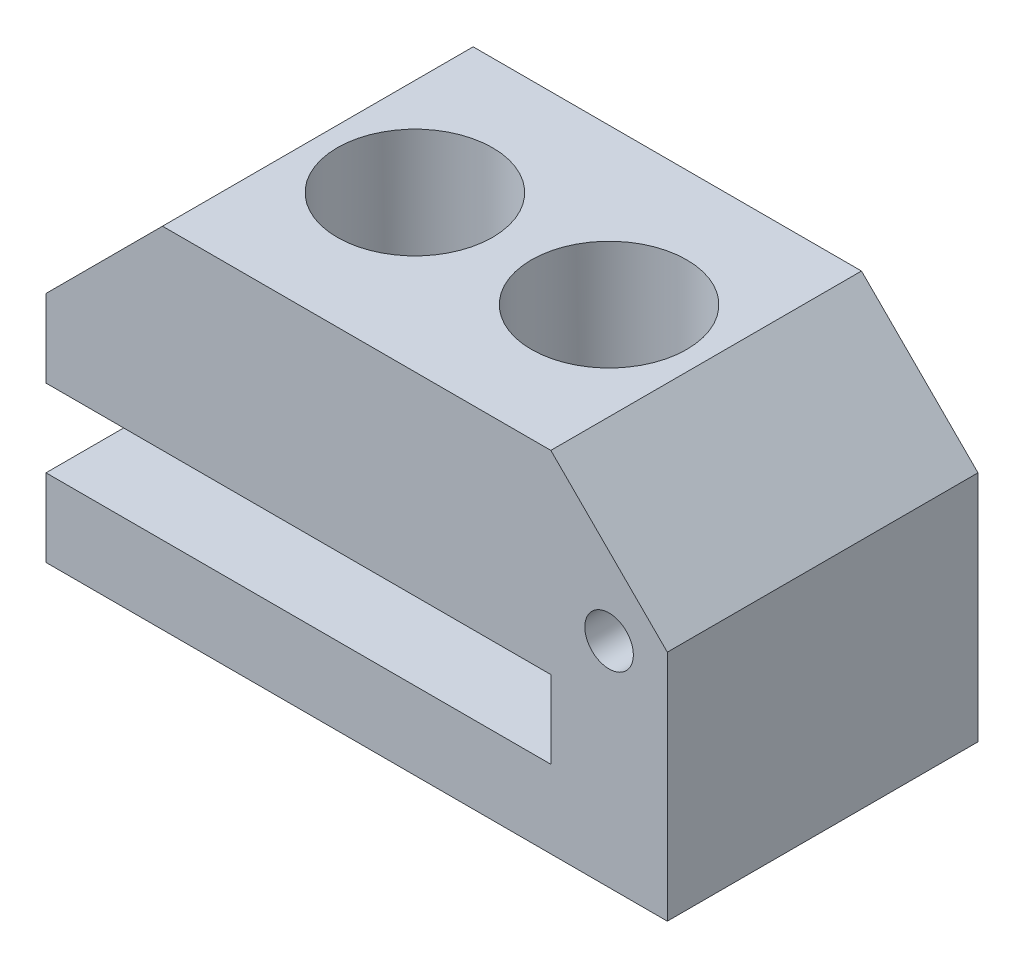
from build123d import *

# Parameters (mm, degrees)
BOSS_EXTRUDE1_DEPTH = 16
SKETCH2_R           = 4
CUT_EXTRUDE1_DEPTH  = 40
SKETCH3_W           = 26
SKETCH3_H           = 4
CUT_EXTRUDE2_DEPTH  = 40
SKETCH4_R           = 1.25
CUT_EXTRUDE3_DEPTH  = 40


with BuildPart() as part:
    # Sketch1 → Boss-Extrude1 (new body)
    with BuildSketch(Plane.XY):
        Polygon((0, 0), (32, 0), (32, 12), (26, 18), (6, 18), (0, 12), align=None)
    extrude(amount=BOSS_EXTRUDE1_DEPTH)

    # Sketch2 → Cut-Extrude1 (cut, symmetric)
    with BuildSketch(Plane(origin=(0, 0, 0), x_dir=(1, 0, 0), z_dir=(0, 1, 0))):
        with Locations((11, -8)):
            Circle(SKETCH2_R)
        with Locations((21, -8)):
            Circle(SKETCH2_R)
    extrude(amount=CUT_EXTRUDE1_DEPTH, both=True, mode=Mode.SUBTRACT)

    # Sketch3 → Cut-Extrude2 (cut, symmetric)
    with BuildSketch(Plane.XY):
        with Locations((13, 6)):
            Rectangle(SKETCH3_W, SKETCH3_H)
    extrude(amount=CUT_EXTRUDE2_DEPTH, both=True, mode=Mode.SUBTRACT)

    # Sketch4 → Cut-Extrude3 (cut, symmetric)
    with BuildSketch(Plane.XY):
        with Locations((29, 11)):
            Circle(SKETCH4_R)
    extrude(amount=CUT_EXTRUDE3_DEPTH, both=True, mode=Mode.SUBTRACT)


solid = part.part
